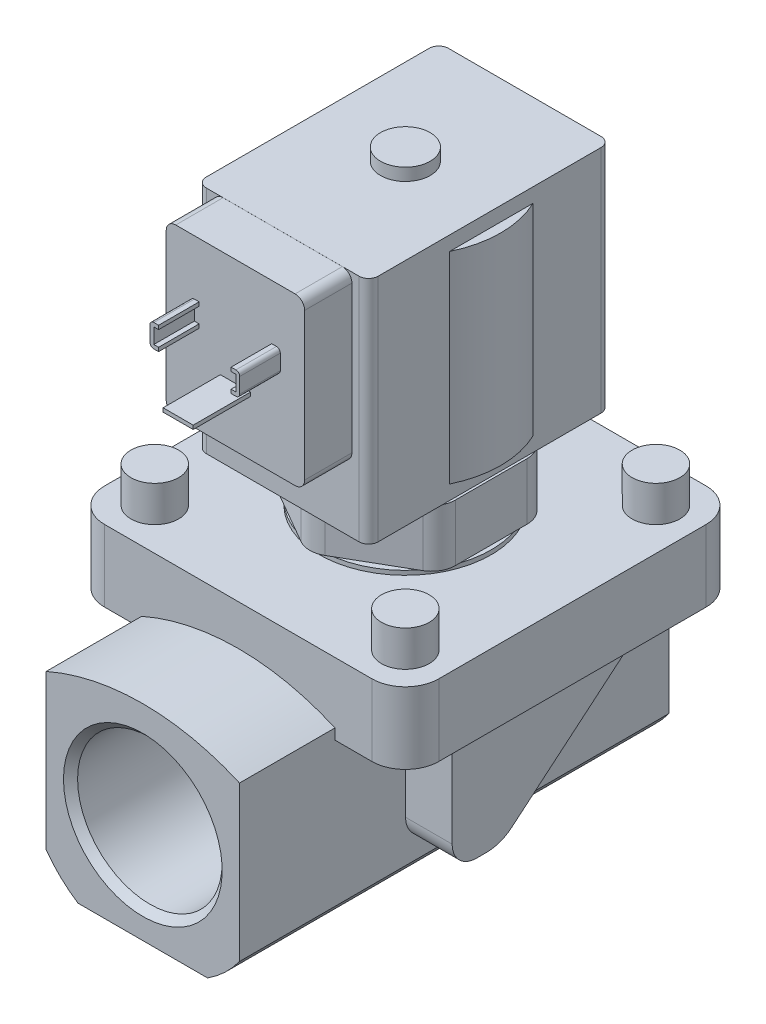
from build123d import *

# Parameters (mm, degrees)
IZIM1_W                      = 50.7
IZIM1_H                      = 48.2
Y_KSEKLIK_EKSTR_ZYON1_DEPTH  = 26.7
IZIM2_R                      = 8.7
Y_KSEKLIK_EKSTR_ZYON2_DEPTH  = 0.5
Y_KSEKLIK_EKSTR_ZYON3_DEPTH  = 11.9
IZIM4_R                      = 16.5
Y_KSEKLIK_EKSTR_ZYON4_DEPTH  = 0.9
IZIM5_R                      = 18
Y_KSEKLIK_EKSTR_ZYON5_DEPTH  = 0.9
Y_KSEKLIK_EKSTR_ZYON6_DEPTH  = 36
Y_KSEKLIK_EKSTR_ZYON7_DEPTH  = 17
Y_KSEKLIK_EKSTR_ZYON8_START  = 17
Y_KSEKLIK_EKSTR_ZYON8_DEPTH  = 17
IZIM9_W                      = 14.75
IZIM9_H                      = 70
KES_EKSTR_ZYON1_DEPTH        = 30.160746911
IZIM10_W                     = 14.75
IZIM10_H                     = 70
KES_EKSTR_ZYON2_DEPTH        = 30.160746911
IZIM11_W                     = 50.7
IZIM11_H                     = 48.2
Y_KSEKLIK_EKSTR_ZYON9_DEPTH  = 9.3
Y_KSEKLIK_EKSTR_ZYON10_START = 20
Y_KSEKLIK_EKSTR_ZYON10_DEPTH = 20
IZIM13_W                     = 9.75
IZIM13_H                     = 10.2
Y_KSEKLIK_EKSTR_ZYON11_DEPTH = 26.5
Y_KSEKLIK_EKSTR_ZYON12_DEPTH = 42.2
Y_KSEKLIK_EKSTR_ZYON13_START = -42.2
Y_KSEKLIK_EKSTR_ZYON13_DEPTH = 42.2
IZIM16_W                     = 29
IZIM16_H                     = 34.79
Y_KSEKLIK_EKSTR_ZYON14_DEPTH = 9.9
Y_KSEKLIK_EKSTR_ZYON15_DEPTH = 8.5
Y_KSEKLIK_EKSTR_ZYON16_DEPTH = 8.5
IZIM19_W                     = 6.3
IZIM19_H                     = 0.8
Y_KSEKLIK_EKSTR_ZYON17_DEPTH = 12
DRAFT1_ANGLE                 = 50
IZIM20_W                     = 5
IZIM20_H                     = 7.5
IZIM21_W                     = 5
IZIM21_H                     = 7.5
IZIM22_W                     = 5
IZIM22_H                     = 7.5
IZIM23_W                     = 5
IZIM23_H                     = 7.5
IZIM24_W                     = 5.2
IZIM24_H                     = 2.6
M27_BO_LUKLU_DELIK1_D        = 30.291
M27_BO_LUKLU_DELIK1_DEPTH    = 33.249
M27_BO_LUKLU_DELIK2_D        = 30.291
M27_BO_LUKLU_DELIK2_DEPTH    = 33.249
FEDER1_START                 = -30
FEDER1_DEPTH                 = 9.75
PAH1_SIZE                    = 1.479
RADYUS1_R                    = 0.8
RADYUS2_R                    = 2
RADYUS3_R                    = 5
RADYUS4_R                    = 5.1
RADYUS5_R                    = 7
RADYUS6_R                    = 8.16
L_EK1_SCALE                  = 0.192


# Read off the part's stored shape, not the designer's step: Feder1
with BuildPart() as part:
    # Çizim1 → Yükseklik-Ekstrüzyon1 (new body)
    with BuildSketch(Plane(origin=(18, 0, 0), x_dir=(0, 0, -1), z_dir=(1, 0, 0))):
        with Locations((-0.35, 68.8)):
            Rectangle(IZIM1_W, IZIM1_H)
    extrude(amount=-Y_KSEKLIK_EKSTR_ZYON1_DEPTH)

    # Çizim2 → Yükseklik-Ekstrüzyon2 (add)
    with BuildSketch(Plane.XZ.offset(-44.7)):
        with Locations(Location((0, 0, 0), (0, 0, 180))):
            Circle(IZIM2_R)
    extrude(amount=Y_KSEKLIK_EKSTR_ZYON2_DEPTH)

    # Çizim3 → Yükseklik-Ekstrüzyon3 (add)
    with BuildSketch(Plane(origin=(0, 44.2, 0), x_dir=(1, 0, 0), z_dir=(0, 1, 0))):
        Polygon((-18, 10.392304845), (-18, -10.392304845), (0, -20.784609691), (18, -10.392304845), (18, 10.392304845), (0, 20.784609691), align=None)
    extrude(amount=-Y_KSEKLIK_EKSTR_ZYON3_DEPTH)

    # Çizim4 → Yükseklik-Ekstrüzyon4 (add)
    with BuildSketch(Plane.XZ.offset(-32.3)):
        with Locations(Location((0, 0, 0), (0, 0, 270))):
            Circle(IZIM4_R)
    extrude(amount=Y_KSEKLIK_EKSTR_ZYON4_DEPTH)

    # Çizim5 → Yükseklik-Ekstrüzyon5 (add)
    with BuildSketch(Plane(origin=(0, 31.4, 0), x_dir=(1, 0, 0), z_dir=(0, 1, 0))):
        with Locations(Location((0, 0, 0), (0, 0, 90))):
            Circle(IZIM5_R)
    extrude(amount=-Y_KSEKLIK_EKSTR_ZYON5_DEPTH)

    # Çizim6 → Yükseklik-Ekstrüzyon6 (add)
    with BuildSketch(Plane.XY.offset(18)):
        with BuildLine():
            Line((-13.564659966, -21), (13.564659966, -21))
            ThreePointArc((13.564659966, -21), (17.201870235, -18.14099392), (20.25, -14.660746911))
            Line((20.25, -14.660746911), (35, -14.660746911))
            Line((35, -14.660746911), (35, 30.5))
            Line((35, 30.5), (0, 30.5))
            Line((0, 30.5), (-35, 30.5))
            Line((-35, 30.5), (-35, -14.660746911))
            Line((-35, -14.660746911), (-20.25, -14.660746911))
            ThreePointArc((-20.25, -14.660746911), (-17.201870235, -18.14099392), (-13.564659966, -21))
        make_face()
    extrude(amount=-Y_KSEKLIK_EKSTR_ZYON6_DEPTH)

    # Çizim7 → Yükseklik-Ekstrüzyon7 (add)
    with BuildSketch(Plane(origin=(0, 0, -18), x_dir=(-1, 0, 0), z_dir=(0, 0, -1))):
        with BuildLine():
            Line((13.564659966, -21), (-13.564659966, -21))
            ThreePointArc((-13.564659966, -21), (-17.201870235, -18.14099392), (-20.25, -14.660746911))
            Line((-20.25, -14.660746911), (-35, -14.660746911))
            Line((-35, -14.660746911), (-35, 30.5))
            Line((-35, 30.5), (35, 30.5))
            Line((35, 30.5), (35, -14.660746911))
            Line((35, -14.660746911), (20.25, -14.660746911))
            ThreePointArc((20.25, -14.660746911), (17.201870235, -18.14099392), (13.564659966, -21))
        make_face()
    extrude(amount=Y_KSEKLIK_EKSTR_ZYON7_DEPTH)

    # Çizim8 → Yükseklik-Ekstrüzyon8 (add)
    with BuildSketch(Plane.XY.offset(18).offset(Y_KSEKLIK_EKSTR_ZYON8_START)):
        with BuildLine():
            Line((13.564659966, -21), (-13.564659966, -21))
            ThreePointArc((-13.564659966, -21), (-17.201870235, -18.14099392), (-20.25, -14.660746911))
            Line((-20.25, -14.660746911), (-35, -14.660746911))
            Line((-35, -14.660746911), (-35, 30.5))
            Line((-35, 30.5), (35, 30.5))
            Line((35, 30.5), (35, -14.660746911))
            Line((35, -14.660746911), (20.25, -14.660746911))
            ThreePointArc((20.25, -14.660746911), (17.201870235, -18.14099392), (13.564659966, -21))
        make_face()
    extrude(amount=-Y_KSEKLIK_EKSTR_ZYON8_DEPTH)

    # Çizim9 → Kes-Ekstrüzyon1 (cut)
    with BuildSketch(Plane.XZ.offset(14.660746911)):
        with Locations((27.625, 0)):
            Rectangle(IZIM9_W, IZIM9_H)
    extrude(amount=-KES_EKSTR_ZYON1_DEPTH, mode=Mode.SUBTRACT)

    # Çizim10 → Kes-Ekstrüzyon2 (cut)
    with BuildSketch(Plane.XZ.offset(14.660746911)):
        with Locations((-27.625, 0)):
            Rectangle(IZIM10_W, IZIM10_H)
    extrude(amount=-KES_EKSTR_ZYON2_DEPTH, mode=Mode.SUBTRACT)

    # Çizim11 → Yükseklik-Ekstrüzyon9 (add)
    with BuildSketch(Plane.ZY.offset(8.7)):
        with Locations((0.35, 68.8)):
            Rectangle(IZIM11_W, IZIM11_H)
    extrude(amount=Y_KSEKLIK_EKSTR_ZYON9_DEPTH)

    # Çizim12 → Yükseklik-Ekstrüzyon10 (add)
    with BuildSketch(Plane.XY.offset(35).offset(Y_KSEKLIK_EKSTR_ZYON10_START)):
        with BuildLine():
            Line((-20.25, -14.660746911), (-20.25, 17.715834237))
            ThreePointArc((-20.25, 17.715834237), (0, 22), (20.25, 17.715834237))
            Line((20.25, 17.715834237), (20.25, -14.660746911))
            ThreePointArc((20.25, -14.660746911), (17.201870235, -18.14099392), (13.564659966, -21))
            Line((13.564659966, -21), (-13.564659966, -21))
            ThreePointArc((-13.564659966, -21), (-17.201870235, -18.14099392), (-20.25, -14.660746911))
        make_face()
    extrude(amount=-Y_KSEKLIK_EKSTR_ZYON10_DEPTH)

    # Çizim13 → Yükseklik-Ekstrüzyon11 (add)
    with BuildSketch(Plane.XZ.offset(-15.5)):
        with Locations((25.125, 15.1)):
            Rectangle(IZIM13_W, IZIM13_H)
    extrude(amount=Y_KSEKLIK_EKSTR_ZYON11_DEPTH)

    # Çizim14 → Yükseklik-Ekstrüzyon12 (add)
    with BuildSketch(Plane(origin=(0, 89.9, 0), x_dir=(1, 0, 0), z_dir=(0, 1, 0))):
        with BuildLine():
            Line((-18, -8.717797887), (-18, 8.717797887))
            ThreePointArc((-18, 8.717797887), (-20, 0), (-18, -8.717797887))
        make_face()
    extrude(amount=-Y_KSEKLIK_EKSTR_ZYON12_DEPTH)

    # Çizim15 → Yükseklik-Ekstrüzyon13 (add)
    with BuildSketch(Plane.XZ.offset(-47.7).offset(Y_KSEKLIK_EKSTR_ZYON13_START)):
        with BuildLine():
            Line((18, 8.717797887), (18, -8.717797887))
            ThreePointArc((18, -8.717797887), (20, 0), (18, 8.717797887))
        make_face()
    extrude(amount=Y_KSEKLIK_EKSTR_ZYON13_DEPTH)

    # Çizim16 → Yükseklik-Ekstrüzyon14 (add)
    with BuildSketch(Plane.XY.offset(25.7)):
        with Locations((0, 75.495)):
            Rectangle(IZIM16_W, IZIM16_H)
    extrude(amount=Y_KSEKLIK_EKSTR_ZYON14_DEPTH)

    # Çizim17 → Yükseklik-Ekstrüzyon15 (add)
    with BuildSketch(Plane.XY.offset(35.6)):
        Polygon((-9.4, 81.4), (-7.6, 81.4), (-7.6, 80.6), (-8.6, 80.6), (-8.6, 77.4), (-7.6, 77.4), (-7.6, 76.6), (-9.4, 76.6), align=None)
    extrude(amount=Y_KSEKLIK_EKSTR_ZYON15_DEPTH)

    # Çizim18 → Yükseklik-Ekstrüzyon16 (add)
    with BuildSketch(Plane.XY.offset(35.6)):
        Polygon((7.6, 77.4), (8.6, 77.4), (8.6, 80.6), (7.6, 80.6), (7.6, 81.4), (9.4, 81.4), (9.4, 76.6), (7.6, 76.6), align=None)
    extrude(amount=Y_KSEKLIK_EKSTR_ZYON16_DEPTH)

    # Çizim19 → Yükseklik-Ekstrüzyon17 (add)
    with BuildSketch(Plane.XY.offset(35.6)):
        with Locations((0, 70)):
            Rectangle(IZIM19_W, IZIM19_H)
    extrude(amount=Y_KSEKLIK_EKSTR_ZYON17_DEPTH)

    # Draft1
    draft1_faces = [part.faces().sort_by_distance(p)[0] for p in [
        (25.125, 2.25, 10),
    ]]
    draft(draft1_faces, Plane(origin=(0, -11, 0), x_dir=(0, 0, -1), z_dir=(0, -1, 0)), DRAFT1_ANGLE)

    # Çizim20 → Döndür1 (revolve)
    with BuildSketch(Plane.XY.offset(26.25), mode=Mode.PRIVATE) as d_nd_r1_sk:
        with Locations((-23.75, 34.25)):
            Rectangle(IZIM20_W, IZIM20_H)
    revolve(d_nd_r1_sk.sketch.rotate(Axis((-26.25, 38, 26.25), (0, -1, 0)), 270), axis=Axis((-26.25, 38, 26.25), (0, -1, 0)))

    # Çizim21 → Döndür2 (revolve)
    with BuildSketch(Plane.XY.offset(-26.25), mode=Mode.PRIVATE) as d_nd_r2_sk:
        with Locations((-23.75, 34.25)):
            Rectangle(IZIM21_W, IZIM21_H)
    revolve(d_nd_r2_sk.sketch.rotate(Axis((-26.25, 38, -26.25), (0, -1, 0)), 270), axis=Axis((-26.25, 38, -26.25), (0, -1, 0)))

    # Çizim22 → Döndür3 (revolve)
    with BuildSketch(Plane.XY.offset(-26.25), mode=Mode.PRIVATE) as d_nd_r3_sk:
        with Locations((28.75, 34.25)):
            Rectangle(IZIM22_W, IZIM22_H)
    revolve(d_nd_r3_sk.sketch.rotate(Axis((26.25, 38, -26.25), (0, -1, 0)), 270), axis=Axis((26.25, 38, -26.25), (0, -1, 0)))

    # Çizim23 → Döndür4 (revolve)
    with BuildSketch(Plane.XY.offset(26.25), mode=Mode.PRIVATE) as d_nd_r4_sk:
        with Locations((28.75, 34.25)):
            Rectangle(IZIM23_W, IZIM23_H)
    revolve(d_nd_r4_sk.sketch.rotate(Axis((26.25, 38, 26.25), (0, -1, 0)), 270), axis=Axis((26.25, 38, 26.25), (0, -1, 0)))

    # Çizim24 → Döndür5 (revolve)
    with BuildSketch(Plane(origin=(0, 0, 0), x_dir=(-1, 0, 0), z_dir=(0, 0, -1)), mode=Mode.PRIVATE) as d_nd_r5_sk:
        with Locations((-2.6, 94.2)):
            Rectangle(IZIM24_W, IZIM24_H)
    revolve(d_nd_r5_sk.sketch.rotate(Axis((0, 92.9, 0), (0, 1, 0)), 90), axis=Axis((0, 92.9, 0), (0, 1, 0)))

    # M27 Boşluklu Delik1
    with Locations(Plane.XY.offset(55)):
        with Locations((0, 0)):
            Hole(M27_BO_LUKLU_DELIK1_D / 2, depth=M27_BO_LUKLU_DELIK1_DEPTH)

    # M27 Boşluklu Delik2
    with Locations(Plane(origin=(0, 0, -35), x_dir=(-1, 0, 0), z_dir=(0, 0, -1))):
        with Locations((0, 0)):
            Hole(M27_BO_LUKLU_DELIK2_D / 2, depth=M27_BO_LUKLU_DELIK2_DEPTH)

    # Feder1 outline → Feder1 (add)
    with BuildSketch(Plane.YZ.offset(FEDER1_START)):
        Polygon((15.5, 19.826070485), (-9.313312955, 19.826070485), (-12.686687045, 12.591846402), (15.5, -20.999739147), align=None)
    extrude(amount=FEDER1_DEPTH)

    # Pah1
    pah1_edges = [part.edges().sort_by_distance(p)[0] for p in [
        (15.1455, 0, 55),
        (-15.1455, 0, -35),
    ]]
    chamfer(pah1_edges, length=PAH1_SIZE)

    # Radyus1
    radyus1_edges = [part.edges().sort_by_distance(p)[0] for p in [
        (-9.4, 81.4, 39.85),
        (-9.4, 76.6, 39.85),
        (9.4, 76.6, 39.85),
        (9.4, 81.4, 39.85),
    ]]
    fillet(radyus1_edges, radius=RADYUS1_R)

    # Radyus2
    radyus2_edges = [part.edges().sort_by_distance(p)[0] for p in [
        (-18, 68.8, -25),
        (-18, 68.8, 25.7),
        (-14.5, 92.89, 30.65),
        (-14.5, 58.1, 30.65),
        (14.5, 58.1, 30.65),
        (14.5, 92.89, 30.65),
        (18, 68.8, 25.7),
        (18, 68.8, -25),
    ]]
    fillet(radyus2_edges, radius=RADYUS2_R)

    # Radyus3
    radyus3_edges = [part.edges().sort_by_distance(p)[0] for p in [
        (-18, 38.25, -10.392304845),
        (0, 38.25, -20.784609691),
        (18, 38.25, -10.392304845),
        (18, 38.25, 10.392304845),
        (0, 38.25, 20.784609691),
        (-18, 38.25, 10.392304845),
    ]]
    fillet(radyus3_edges, radius=RADYUS3_R)

    # Radyus4
    radyus4_edges = [part.edges().sort_by_distance(p)[0] for p in [
        (25.125, -11, 20.2),
    ]]
    fillet(radyus4_edges, radius=RADYUS4_R)

    # Radyus5
    radyus5_edges = [part.edges().sort_by_distance(p)[0] for p in [
        (35, 23, 35),
        (-35, 23, -35),
        (35, 23, -35),
        (-35, 23, 35),
    ]]
    fillet(radyus5_edges, radius=RADYUS5_R)

    # Radyus6
    radyus6_edges = [part.edges().sort_by_distance(p)[0] for p in [
        (25.125, -11, 10),
    ]]
    fillet(radyus6_edges, radius=RADYUS6_R)


with BuildPart() as part_1:
    # Ölçek1: scaled about (0.014445195, 31.538640435, 4.897050437)
    add(part.part.scale(L_EK1_SCALE).moved(Location((0.011671718, 25.483221471, 3.956816753))))


solid = part_1.part
